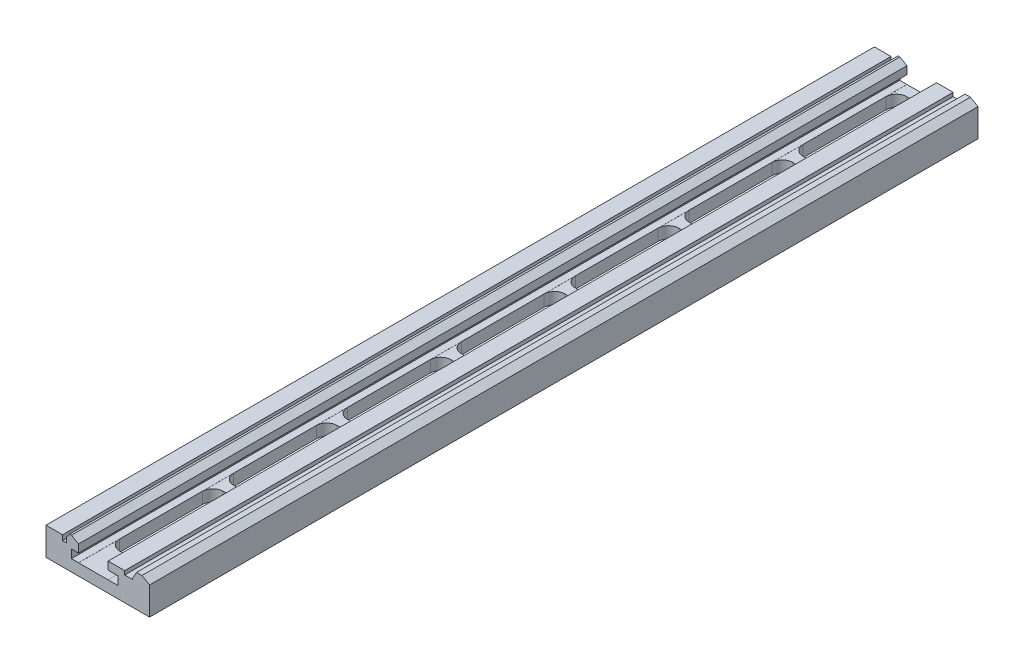
from build123d import *

# Parameters (mm, degrees)
BOSS_EXTRUDE1_DEPTH = 800
CUT_EXTRUDE1_DEPTH  = 800
LPATTERN1_COUNT     = 7
LPATTERN1_PITCH     = 110
SKETCH3_W           = 44.820678355
SKETCH3_H           = 8.070390001
CUT_EXTRUDE2_DEPTH  = 800


with BuildPart() as part:
    # Sketch1 → Boss-Extrude1 (new body)
    with BuildSketch(Plane.XY):
        Polygon((-31.780730897, 35.465116279), (-39.131236442, 39.706477013), (-44.327140061, 39.706477013), (-48.46269055, 32.539346297), (-48.46269055, 31.810631229), (-55.780730897, 31.810631229), (-55.780730897, 35.465116279), (-71.780730897, 35.465116279), (-71.780730897, 19.684385382), (-100.38538206, 19.684385382), (-100.38538206, 35.465116279), (-107.160551558, 39.374498797), (-109.002114165, 39.374498797), (-111.780730897, 35.465116279), (-111.780730897, 30.481727575), (-115.780730897, 30.481727575), (-115.780730897, 35.465116279), (-131.780730897, 35.465116279), (-131.780730897, 8.554817276), (-31.780730897, 8.554817276), align=None)
    extrude(amount=BOSS_EXTRUDE1_DEPTH)

    # Sketch2 → Cut-Extrude1 (cut)
    with BuildSketch(Plane(origin=(0, 19.684385382, 0), x_dir=(1, 0, 0), z_dir=(0, 1, 0))):
        with BuildLine():
            Line((-90.38538206, -10.291353804), (-81.780730897, -10.291353804))
            ThreePointArc((-81.780730897, -10.291353804), (-74.709663085, -13.220285992), (-71.780730897, -20.291353804))
            Line((-71.780730897, -20.291353804), (-71.780730897, -100.291353804))
            ThreePointArc((-71.780730897, -100.291353804), (-74.709663085, -107.362421616), (-81.780730897, -110.291353804))
            Line((-81.780730897, -110.291353804), (-90.38538206, -110.291353804))
            ThreePointArc((-90.38538206, -110.291353804), (-97.456449872, -107.362421616), (-100.38538206, -100.291353804))
            Line((-100.38538206, -100.291353804), (-100.38538206, -20.291353804))
            ThreePointArc((-100.38538206, -20.291353804), (-97.456449872, -13.220285992), (-90.38538206, -10.291353804))
        make_face()
    cut_extrude1 = extrude(amount=-CUT_EXTRUDE1_DEPTH, mode=Mode.SUBTRACT)

    # LPattern1: Cut-Extrude1 ×7
    with Locations(*[(0, 0, i * LPATTERN1_PITCH) for i in range(1, LPATTERN1_COUNT)]):
        add(cut_extrude1, mode=Mode.SUBTRACT)

    # Sketch3 → Cut-Extrude2 (cut)
    with BuildSketch(Plane.XY.offset(800)):
        with Locations((-84.848813046, 23.797159955)):
            Rectangle(SKETCH3_W, SKETCH3_H)
    extrude(amount=-CUT_EXTRUDE2_DEPTH, mode=Mode.SUBTRACT)


solid = part.part
